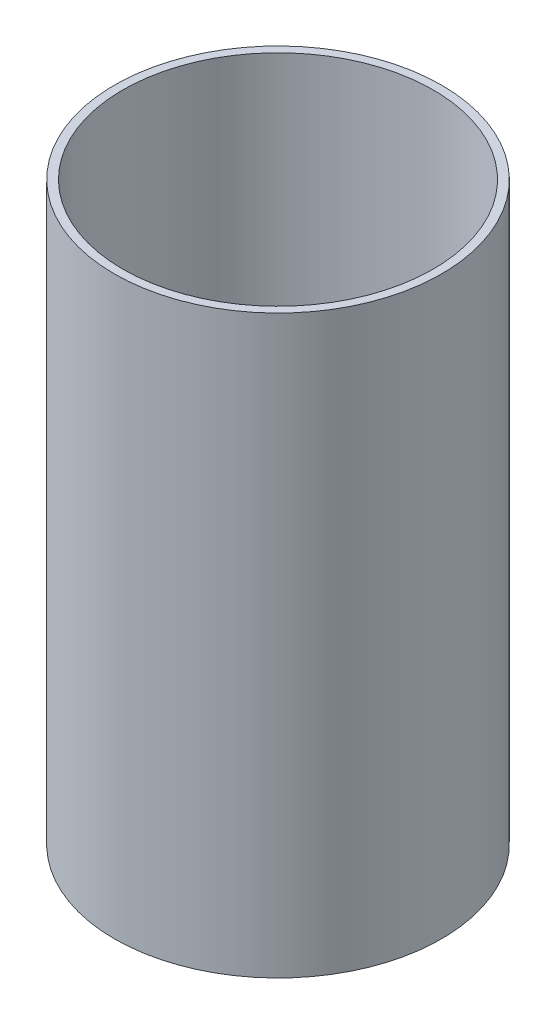
from build123d import *

# Parameters (mm, degrees)
SKETCH1_R           = 93.6625
SKETCH1_R_2         = 88.9
BOSS_EXTRUDE1_DEPTH = 164.87775


with BuildPart() as part:
    # Sketch1 → Boss-Extrude1 (new, symmetric)
    with BuildSketch(Plane(origin=(0, 0, 0), x_dir=(1, 0, 0), z_dir=(0, 1, 0))):
        Circle(SKETCH1_R)
        Circle(SKETCH1_R_2, mode=Mode.SUBTRACT)
    extrude(amount=BOSS_EXTRUDE1_DEPTH, both=True)


solid = part.part
